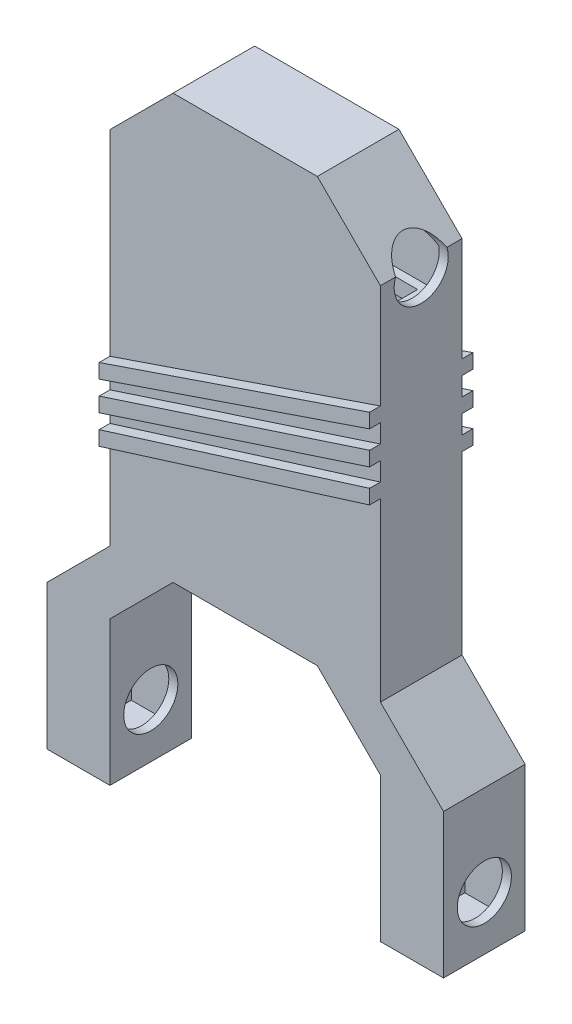
from build123d import *

# Parameters (mm, degrees)
BOSS_EXTRUDE1_DEPTH    = 28.75
CUT_EXTRUDE1_START     = -42.065454849
CUT_EXTRUDE1_OUTLINE_R = 19.05
CUT_EXTRUDE1_DEPTH     = 95.25
CUT_EXTRUDE2_START     = 53.184545151
CUT_EXTRUDE2_OUTLINE_R = 19.05
CUT_EXTRUDE2_DEPTH     = 44.45
CUT_EXTRUDE3_DEPTH     = 53.134
BOSS_EXTRUDE2_DEPTH    = 4.112
BOSS_EXTRUDE3_START    = -27.178
BOSS_EXTRUDE3_DEPTH    = 54.749324395
CUT_EXTRUDE4_DEPTH     = 202.577324395
CUT_EXTRUDE5_DEPTH     = 20.713324395
BOSS_EXTRUDE4_DEPTH    = 7.62


# Read off the part's stored shape, not the designer's step: Cut-Extrude1, Cut-Extrude2
with BuildPart() as part:
    # Sketch1 → Boss-Extrude1 (new, symmetric)
    with BuildSketch(Plane.XY):
        Polygon((-42.065454849, 178.227776477), (8.734545151, 178.227776477), (53.184545151, 133.777776477), (53.184545151, -120.222223523), (97.634545151, -164.672223523), (97.634545151, -266.272223523), (53.184545151, -266.272223523), (53.184545151, -164.672223523), (8.734545151, -120.222223523), (-42.065454849, -120.222223523), align=None)
    boss_extrude1 = extrude(amount=BOSS_EXTRUDE1_DEPTH, both=True)

    # Cut-Extrude1 outline → Cut-Extrude1 (cut)
    with BuildSketch(Plane.YZ.offset(CUT_EXTRUDE1_START)):
        with Locations((127.685773621, 0)):
            Circle(CUT_EXTRUDE1_OUTLINE_R)
    cut_extrude1 = extrude(amount=CUT_EXTRUDE1_DEPTH, mode=Mode.SUBTRACT)

    # Cut-Extrude2 outline → Cut-Extrude2 (cut)
    with BuildSketch(Plane.YZ.offset(CUT_EXTRUDE2_START)):
        with Locations((-228.289860631, 0)):
            Circle(CUT_EXTRUDE2_OUTLINE_R)
    cut_extrude2 = extrude(amount=CUT_EXTRUDE2_DEPTH, mode=Mode.SUBTRACT)

    # 3DSketch3 → Cut-Extrude3 (cut)
    with BuildSketch(Plane(origin=(46.834545151, 131.147520356, 28.75), x_dir=(0.11293541447272491, -0.9936023309945855, 0), z_dir=(0, 0, -1))):
        Polygon((0, 0), (-45.069565781, 35.869789067), (-49.792495889, 77.421984067), (234.129370193, 109.693278753), (239.446398432, 62.914226527), (292.748038223, 20.492726715), (390.002088863, 31.546874009), (393.587788273, 0), (301.560594859, -10.460049163), (252.374992073, 28.685595276), align=None)
    cut_extrude3 = extrude(amount=CUT_EXTRUDE3_DEPTH, mode=Mode.SUBTRACT)

    # 3DSketch4 → Boss-Extrude2 (add)
    with BuildSketch(Plane(origin=(46.834545151, 131.147520356, 28.75), x_dir=(0.11293541447272491, -0.9936023309945855, 0), z_dir=(0, 0, -1))):
        Polygon((0, 0), (-45.069565781, 35.869789067), (-49.792495889, 77.421984067), (234.129370193, 109.693278753), (239.446398432, 62.914226527), (292.748038223, 20.492726715), (390.002088863, 31.546874009), (393.587788273, 0), (301.560594859, -10.460049163), (252.374992073, 28.685595276), align=None)
    boss_extrude2 = extrude(amount=BOSS_EXTRUDE2_DEPTH)

    # 3DSketch5 → Boss-Extrude3 (add)
    with BuildSketch(Plane(origin=(-35.720345309, 97.493542441, 0), x_dir=(0.40083597519613967, -0.9161498354464512, 0), z_dir=(0, 0, -1)).offset(BOSS_EXTRUDE3_START)):
        Polygon((0, 0), (33.052442893, -75.544591783), (43.045438997, -71.17243323), (9.992996103, 4.372158552), align=None)
        Polygon((10.211294878, 4.467669132), (97.619851165, -47.194184385), (112.530011029, -40.7239593), (25.069632619, 10.968523106), align=None)
        Polygon((114.65997341, -39.792053279), (150.181388224, 65.707705089), (158.956447642, 69.546989192), (124.376634497, -35.540797457), align=None)
        Polygon((159.730050967, 69.885457892), (192.765078264, -5.61932884), (206.16905235, 0.245208615), (173.134025054, 75.749995347), align=None)
        Polygon((292.774824976, 23.83011217), (305.305385667, -4.809710164), (316.298448785, 0), (303.767888094, 28.639822334), align=None)
    boss_extrude3 = extrude(amount=BOSS_EXTRUDE3_DEPTH)

    # 3DSketch6 → Cut-Extrude4 (cut)
    with BuildSketch(Plane(origin=(32.296663071, 97.493542441, 16.41736958), x_dir=(-0.8658016878716993, 0, -0.500387287287074), z_dir=(0, -1, 0))):
        Polygon((0, 0), (52.080166138, -30.0995637), (69.476111698, 0), (17.39594556, 30.0995637), align=None)
    cut_extrude4 = extrude(amount=CUT_EXTRUDE4_DEPTH, mode=Mode.SUBTRACT)

    # 3DSketch7 → Cut-Extrude5 (cut)
    with BuildSketch(Plane(origin=(68.903586313, -192.283229366, -16.429287804), x_dir=(0.44451752127231664, 0, 0.8957701565032827), z_dir=(0, 1, 0))):
        Polygon((0, 0), (7.166847229, 14.442283053), (36.270235806, 0), (29.103388576, -14.442283053), align=None)
    cut_extrude5 = extrude(amount=CUT_EXTRUDE5_DEPTH, mode=Mode.SUBTRACT)

    # Mirror1: Boss-Extrude1, Cut-Extrude1, Cut-Extrude2, Cut-Extrude3, Boss-Extrude2, Boss-Extrude3, Cut-Extrude4, Cut-Extrude5 across plane
    add(boss_extrude1.mirror(Plane.ZY.offset(42.065454849)))
    add(cut_extrude1.mirror(Plane.ZY.offset(42.065454849)), mode=Mode.SUBTRACT)
    add(cut_extrude2.mirror(Plane.ZY.offset(42.065454849)), mode=Mode.SUBTRACT)
    add(cut_extrude3.mirror(Plane.ZY.offset(42.065454849)), mode=Mode.SUBTRACT)
    add(boss_extrude2.mirror(Plane.ZY.offset(42.065454849)))
    add(boss_extrude3.mirror(Plane.ZY.offset(42.065454849)))
    add(cut_extrude4.mirror(Plane.ZY.offset(42.065454849)), mode=Mode.SUBTRACT)
    add(cut_extrude5.mirror(Plane.ZY.offset(42.065454849)), mode=Mode.SUBTRACT)

    # 3DSketch9 → Boss-Extrude4 (add)
    with BuildSketch(Plane(origin=(-137.315454849, -4.488399548, 28.75), x_dir=(0.9465739872081231, 0.3224867233560418, 0), z_dir=(0, 0, -1))):
        Polygon((0, 0), (201.252097115, 0), (197.975632006, 9.61719171), (-3.276465109, 9.61719171), align=None)
        Polygon((193.766582726, 21.971736163), (-6.608260614, 19.396791076), (-9.884725723, 29.013982786), (190.490117616, 31.588927873), align=None)
        Polygon((-13.209693182, 38.77354024), (186.286048611, 43.928854055), (183.009583502, 53.546045765), (-16.486158291, 48.39073195), align=None)
    boss_extrude4 = extrude(amount=-BOSS_EXTRUDE4_DEPTH)

    # Mirror2: Boss-Extrude4 across plane
    add(boss_extrude4.mirror(Plane.XY))


solid = part.part
